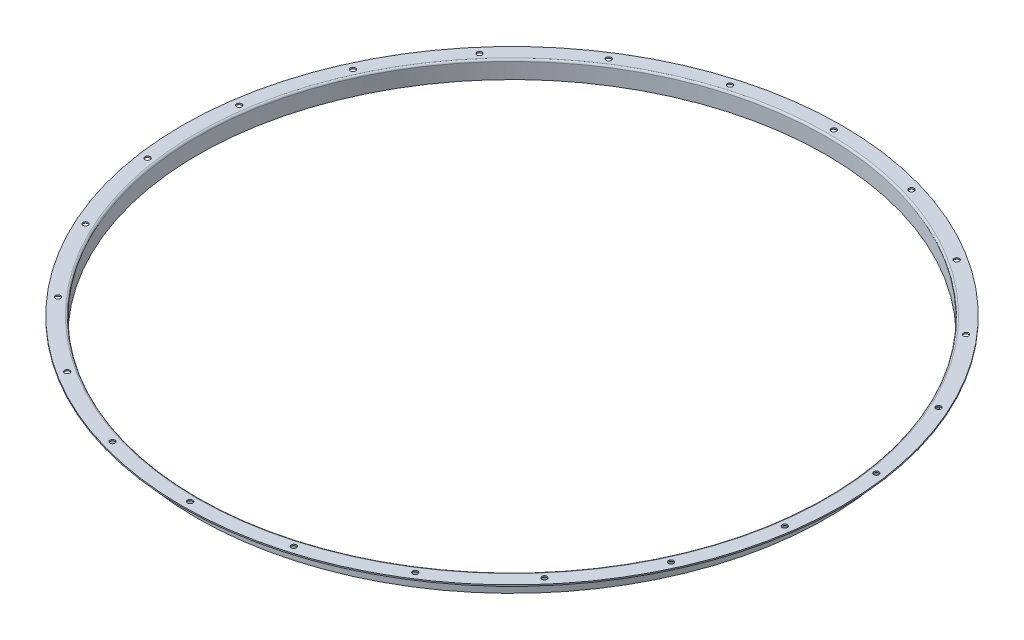
from build123d import *

# Parameters (mm, degrees)
SKETCH1_R          = 630
SKETCH1_R_2        = 600
BASE_FLANGE1_DEPTH = 2.5
SKETCH8_R          = 5
CUT_EXTRUDE1_DEPTH = 10


# Read off the part's stored shape, not the designer's step: Edge-Flange1
# Sheet-metal steps are written as plain solids
with BuildPart() as part:
    # Sketch1 → Base-Flange1 (new body)
    with BuildSketch(Plane(origin=(0, 0, 0), x_dir=(1, 0, 0), z_dir=(0, 1, 0))):
        with Locations(Location((0, 0, 0), (0, 0, 270))):
            Circle(SKETCH1_R)
        with Locations(Location((0, 0, 0), (0, 0, 270))):
            Circle(SKETCH1_R_2, mode=Mode.SUBTRACT)
    extrude(amount=-BASE_FLANGE1_DEPTH)

    # Edge-Flange1 outline → Edge-Flange1 (revolve, cut)
    with BuildSketch(Plane.XY):
        with BuildLine():
            Line((600, -2.5), (600.145898034, -2.5))
            ThreePointArc((600.145898034, -2.5), (601.408349934, -0.69375696), (603.5, 0))
            Line((603.5, 0), (600, 0))
            Line((600, 0), (600, -2.5))
        make_face()
    revolve(axis=Axis((0, 0, 0), (0, 1, 0)), mode=Mode.SUBTRACT)

    # Edge-Flange1 2 outline → Edge-Flange1 2 (revolve)
    with BuildSketch(Plane.XY):
        with BuildLine():
            Line((600, -3.5), (600, -33.5))
            Line((600, -33.5), (602.5, -33.5))
            Line((602.5, -33.5), (602.5, -3.5))
            ThreePointArc((602.5, -3.5), (602.792893219, -2.792893219), (603.5, -2.5))
            Line((603.5, -2.5), (600.145898034, -2.5))
            ThreePointArc((600.145898034, -2.5), (600.036666571, -2.994706462), (600, -3.5))
        make_face()
    revolve(axis=Axis((0, 0, 0), (0, 1, 0)))

    # Sketch8 → Cut-Extrude1 (cut)
    with BuildSketch(Plane(origin=(0, 0, 0), x_dir=(1, 0, 0), z_dir=(0, 1, 0))):
        with Locations(Location((173.265522457, 590.088178773, 0), (0, 0, 270))):
            Circle(SKETCH8_R)
        with Locations(Location((332.494102735, 517.370922691, 0), (0, 0, 270))):
            Circle(SKETCH8_R)
        with Locations(Location((0, 615, 0), (0, 0, 270))):
            Circle(SKETCH8_R)
        with Locations(Location((464.785988228, 402.739351376, 0), (0, 0, 270))):
            Circle(SKETCH8_R)
        with Locations(Location((559.423677143, 255.480232996, 0), (0, 0, 270))):
            Circle(SKETCH8_R)
        with Locations(Location((608.740186757, 87.523625538, 0), (0, 0, 270))):
            Circle(SKETCH8_R)
        with Locations(Location((608.740186757, -87.523625538, 0), (0, 0, 270))):
            Circle(SKETCH8_R)
        with Locations(Location((559.423677143, -255.480232996, 0), (0, 0, 270))):
            Circle(SKETCH8_R)
        with Locations(Location((464.785988228, -402.739351376, 0), (0, 0, 270))):
            Circle(SKETCH8_R)
        with Locations(Location((332.494102735, -517.370922691, 0), (0, 0, 270))):
            Circle(SKETCH8_R)
        with Locations(Location((173.265522458, -590.088178773, 0), (0, 0, 270))):
            Circle(SKETCH8_R)
        with Locations(Location((0, -615, 0), (0, 0, 270))):
            Circle(SKETCH8_R)
        with Locations(Location((-173.265522457, -590.088178773, 0), (0, 0, 270))):
            Circle(SKETCH8_R)
        with Locations(Location((-332.494102735, -517.370922691, 0), (0, 0, 270))):
            Circle(SKETCH8_R)
        with Locations(Location((-464.785988228, -402.739351376, 0), (0, 0, 270))):
            Circle(SKETCH8_R)
        with Locations(Location((-559.423677143, -255.480232996, 0), (0, 0, 270))):
            Circle(SKETCH8_R)
        with Locations(Location((-608.740186757, -87.523625538, 0), (0, 0, 270))):
            Circle(SKETCH8_R)
        with Locations(Location((-608.740186757, 87.523625538, 0), (0, 0, 270))):
            Circle(SKETCH8_R)
        with Locations(Location((-559.423677143, 255.480232996, 0), (0, 0, 270))):
            Circle(SKETCH8_R)
        with Locations(Location((-464.785988228, 402.739351376, 0), (0, 0, 270))):
            Circle(SKETCH8_R)
        with Locations(Location((-332.494102735, 517.370922691, 0), (0, 0, 270))):
            Circle(SKETCH8_R)
        with Locations(Location((-173.265522457, 590.088178773, 0), (0, 0, 270))):
            Circle(SKETCH8_R)
    extrude(amount=-CUT_EXTRUDE1_DEPTH, mode=Mode.SUBTRACT)


solid = part.part
